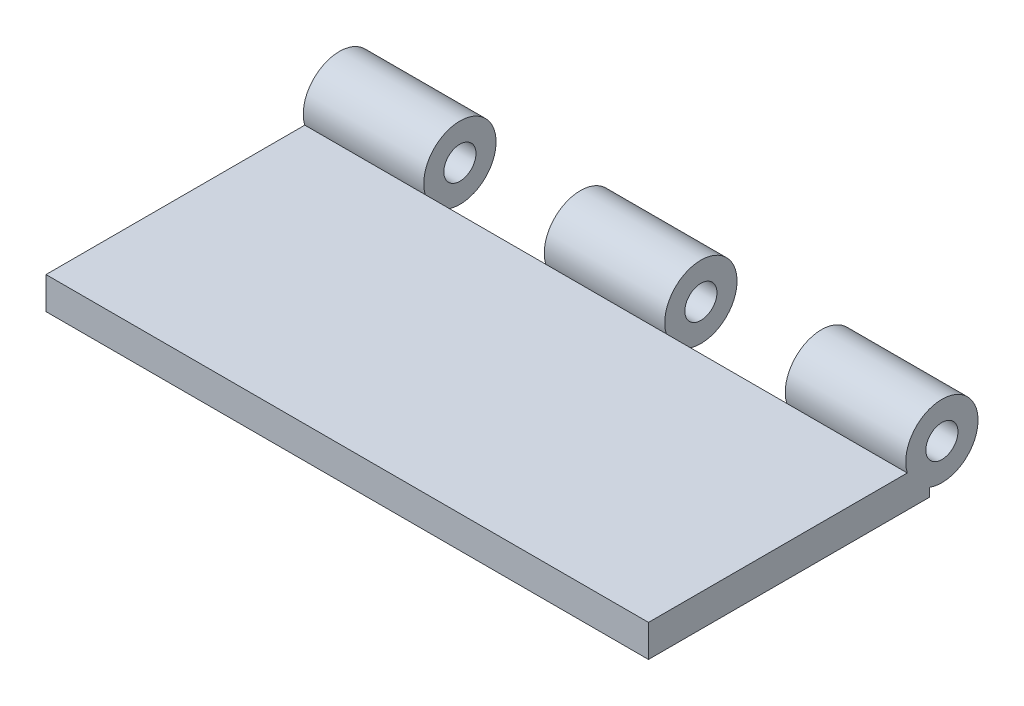
from build123d import *

# Parameters (mm, degrees)
SKETCH1_W           = 150
SKETCH1_H           = 70
BOSS_EXTRUDE1_DEPTH = 8
SKETCH2_R           = 9
BOSS_EXTRUDE2_DEPTH = 30
LPATTERN1_COUNT     = 3
LPATTERN1_PITCH     = 60
CUT_EXTRUDE1_START  = -90
SKETCH4_R           = 9
CUT_EXTRUDE1_DEPTH  = 30
CUT_EXTRUDE2_START  = -30
SKETCH5_R           = 9
CUT_EXTRUDE2_DEPTH  = 30
SCALE1_SCALE        = 0.333333333


with BuildPart() as part:
    # Sketch1 → Boss-Extrude1 (new body)
    with BuildSketch(Plane(origin=(0, 0, 0), x_dir=(1, 0, 0), z_dir=(0, 1, 0))):
        with Locations((-26.196172249, -15.418660287)):
            Rectangle(SKETCH1_W, SKETCH1_H)
    extrude(amount=BOSS_EXTRUDE1_DEPTH)

    # Sketch2 → Boss-Extrude2 (add)
    with BuildSketch(Plane.ZY.offset(101.196172249)):
        with Locations((-22.631021545, 10.588327785)):
            Circle(SKETCH2_R)
        with BuildLine():
            ThreePointArc((-19.581339713, 8), (-26.385933483, 11.966963465), (-18.631021545, 10.588327785))
            ThreePointArc((-18.631021545, 10.588327785), (-18.876109607, 9.209692106), (-19.581339713, 8))
        make_face(mode=Mode.SUBTRACT)
    boss_extrude2 = extrude(amount=-BOSS_EXTRUDE2_DEPTH)

    # LPattern1: Boss-Extrude2 ×3
    with Locations(*[(i * LPATTERN1_PITCH, 0, 0) for i in range(1, LPATTERN1_COUNT)]):
        add(boss_extrude2)

    # Sketch4 → Cut-Extrude1 (cut)
    with BuildSketch(Plane.ZY.offset(101.196172249).offset(CUT_EXTRUDE1_START)):
        with Locations((-22.631021545, 10.588327785)):
            Circle(SKETCH4_R)
    extrude(amount=-CUT_EXTRUDE1_DEPTH, mode=Mode.SUBTRACT)

    # Sketch5 → Cut-Extrude2 (cut)
    with BuildSketch(Plane.ZY.offset(101.196172249).offset(CUT_EXTRUDE2_START)):
        with Locations((-22.631021545, 10.588327785)):
            Circle(SKETCH5_R)
    extrude(amount=-CUT_EXTRUDE2_DEPTH, mode=Mode.SUBTRACT)


with BuildPart() as part_1:
    # Scale1: scaled about (-26.196172249, 5.164536669, 9.439729863)
    add(part.part.scale(SCALE1_SCALE).moved(Location((-17.464114833, 3.443024446, 6.293153242))))


solid = part_1.part
